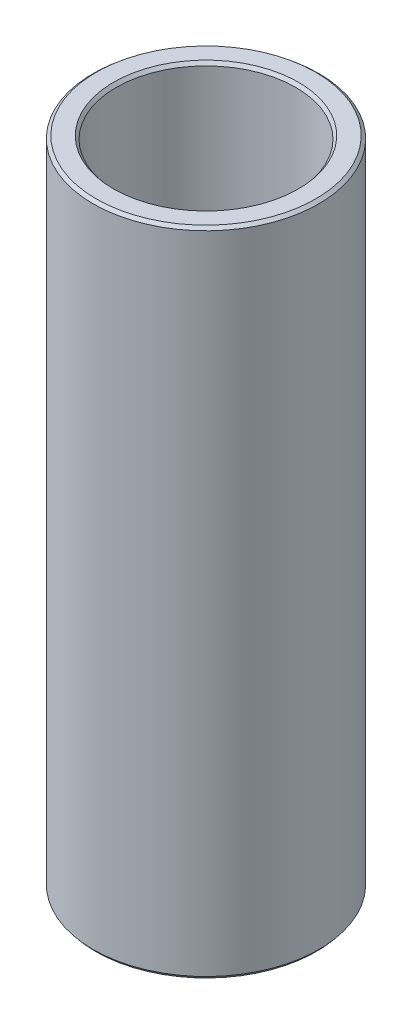
from build123d import *
from OCP.BRepFilletAPI import BRepFilletAPI_MakeChamfer

# Parameters (mm, degrees)
SKETCH1_R           = 57.5
BOSS_EXTRUDE1_DEPTH = 331.847616251
SKETCH2_R           = 45.737299905
CUT_EXTRUDE1_DEPTH  = 342.665538812
CHAMFER1_SIZE       = 1.349450198
CHAMFER1_SIZE2      = 1.612505638


with BuildPart() as part:
    # Sketch1 → Boss-Extrude1 (new body)
    with BuildSketch(Plane(origin=(0, 0, 0), x_dir=(1, 0, 0), z_dir=(0, 1, 0))):
        Circle(SKETCH1_R)
    extrude(amount=BOSS_EXTRUDE1_DEPTH)

    # Sketch2 → Cut-Extrude1 (cut, through all)
    with BuildSketch(Plane(origin=(0, 0, 0), x_dir=(1, 0, 0), z_dir=(0, 1, 0))):
        Circle(SKETCH2_R)
    extrude(amount=CUT_EXTRUDE1_DEPTH, mode=Mode.SUBTRACT)

    # Chamfer1: one chamfer whose edges measure the first distance from different faces: ONE call of the kernel's chamfer builder (chamfer() names one face for all edges)
    chamfer1_edges_1 = [part.edges().sort_by_distance(p)[0] for p in [
        (-45.737299905, 331.847616251, 0),
    ]]
    chamfer1_side_1 = [part.faces().sort_by_distance(p)[0] for p in [
        (-55.873654403, 331.847616251, 0),
    ]]
    chamfer1_edges_2 = [part.edges().sort_by_distance(p)[0] for p in [
        (-45.737299905, 0, 0),
    ]]
    chamfer1_side_2 = [part.faces().sort_by_distance(p)[0] for p in [
        (-45.737299905, 165.923808126, 0),
    ]]
    chamfer1_edges_3 = [part.edges().sort_by_distance(p)[0] for p in [
        (-57.5, 0, 0),
    ]]
    chamfer1_side_3 = [part.faces().sort_by_distance(p)[0] for p in [
        (-55.873654403, 0, 0),
    ]]
    chamfer1_edges_4 = [part.edges().sort_by_distance(p)[0] for p in [
        (-57.5, 331.847616251, 0),
    ]]
    chamfer1_side_4 = [part.faces().sort_by_distance(p)[0] for p in [
        (-57.5, 165.923808126, 0),
    ]]
    chamfer1 = BRepFilletAPI_MakeChamfer(part.part.solid().wrapped)
    for e in chamfer1_edges_1:
        chamfer1.Add(CHAMFER1_SIZE, CHAMFER1_SIZE2, e.wrapped, chamfer1_side_1[0].wrapped)  # the first distance lies on this face
    for e in chamfer1_edges_2:
        chamfer1.Add(CHAMFER1_SIZE, CHAMFER1_SIZE2, e.wrapped, chamfer1_side_2[0].wrapped)  # the first distance lies on this face
    for e in chamfer1_edges_3:
        chamfer1.Add(CHAMFER1_SIZE, CHAMFER1_SIZE2, e.wrapped, chamfer1_side_3[0].wrapped)  # the first distance lies on this face
    for e in chamfer1_edges_4:
        chamfer1.Add(CHAMFER1_SIZE, CHAMFER1_SIZE2, e.wrapped, chamfer1_side_4[0].wrapped)  # the first distance lies on this face
    add(Compound.cast(chamfer1.Shape()), mode=Mode.REPLACE)


solid = part.part
